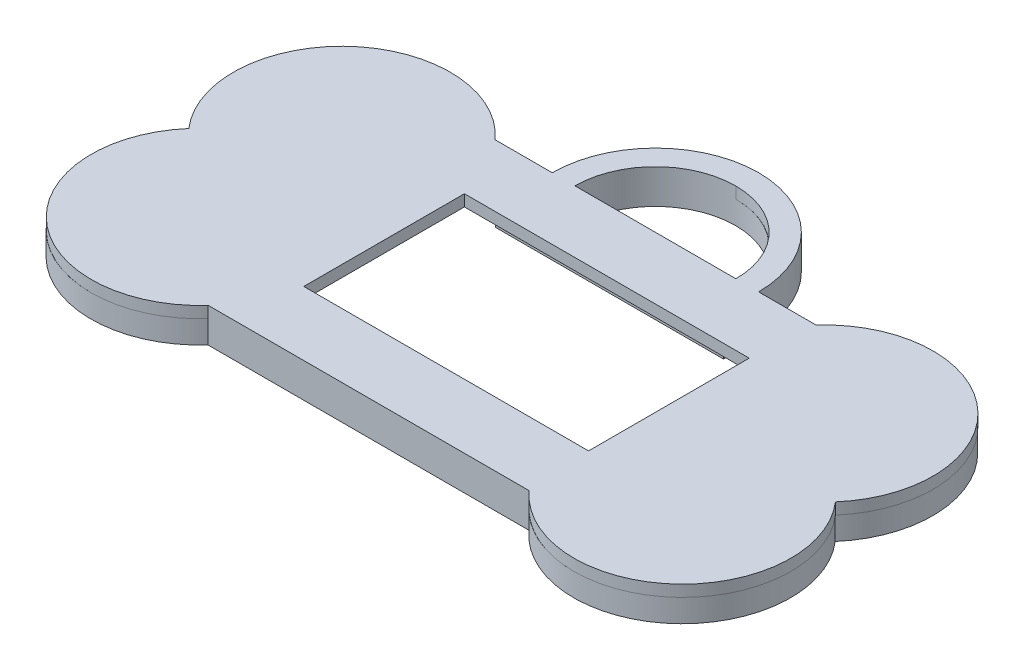
from build123d import *
from build123d.topology import SkipClean

# Parameters (mm, degrees)
SKETCH1_W               = 25.267998505
SKETCH1_H               = 2.54
BOSS_EXTRUDE4_DEPTH     = 2.032
BOSS_EXTRUDE7_OUTLINE_W = 31.52140002
BOSS_EXTRUDE7_OUTLINE_H = 17.78
BOSS_EXTRUDE7_DEPTH     = 1.27
BOSS_EXTRUDE8_START     = -0.508
BOSS_EXTRUDE8_DEPTH     = 0.508


# Read off the part's stored shape, not the designer's step: Boss-Extrude7
with BuildPart() as part:
    # Sketch1 → Boss-Extrude4 (new body)
    # profile 1 of 3: a face of its own
    with BuildSketch(Plane(origin=(0, 0, 0), x_dir=(1, 0, 0), z_dir=(0, 1, 0))):
        with BuildLine():
            ThreePointArc((20.197665706, -14.97393985), (37.082685983, -15.975529809), (38.217517737, 0.901058978))
            ThreePointArc((38.217517737, 0.901058978), (37.082688311, 17.777649884), (20.197665941, 16.776062133))
            Line((20.197665941, 16.776062133), (-15.333719311, 16.776062133))
            ThreePointArc((-15.333719311, 16.776062133), (-32.218740701, 17.777648898), (-33.353569348, 0.901058978))
            ThreePointArc((-33.353569348, 0.901058978), (-32.218738374, -15.975528824), (-15.333719076, -14.97393985))
            Line((-15.333719076, -14.97393985), (20.197665706, -14.97393985))
        make_face()
        with BuildLine():
            ThreePointArc((-29.55002508, 0.901059234), (-31.060989267, -13.57397761), (-16.552025889, -12.43393985))
            Line((-16.552025889, -12.43393985), (21.415972616, -12.43393985))
            ThreePointArc((21.415972616, -12.43393985), (35.924936864, -13.573978674), (34.413973715, 0.901059234))
            ThreePointArc((34.413973715, 0.901059234), (35.924938934, 15.376098834), (21.415972616, 14.236062133))
            Line((21.415972616, 14.236062133), (-16.552025889, 14.236062133))
            ThreePointArc((-16.552025889, 14.236062133), (-31.060991337, 15.376097769), (-29.55002508, 0.901059234))
        make_face(mode=Mode.SUBTRACT)
    # profile 2 of 3: a face of its own
    with BuildSketch(Plane(origin=(0, 0, 0), x_dir=(1, 0, 0), z_dir=(0, 1, 0))):
        with Locations((2.431973364, 12.966062133)):
            Rectangle(SKETCH1_W, SKETCH1_H)
    # profile 3 of 3: a face of its own
    with BuildSketch(Plane(origin=(0, 0, 0), x_dir=(1, 0, 0), z_dir=(0, 1, 0))):
        with BuildLine():
            Line((11.321973315, 16.776062133), (13.861973315, 16.776062133))
            ThreePointArc((13.861973315, 16.776062133), (2.431973315, 28.206062133), (-8.998026685, 16.776062133))
            Line((-8.998026685, 16.776062133), (-6.458026685, 16.776062133))
            ThreePointArc((-6.458026685, 16.776062133), (2.431973315, 25.666062133), (11.321973315, 16.776062133))
        make_face()
    extrude(amount=BOSS_EXTRUDE4_DEPTH)

    # Boss-Extrude7 outline → Boss-Extrude7 (add)
    with BuildSketch(Plane(origin=(0, 2.032, 0), x_dir=(1, 0, 0), z_dir=(0, 1, 0))):
        with BuildLine():
            Line((20.225964487, 16.776056529), (13.861973315, 16.776062133))
            ThreePointArc((13.861973315, 16.776062133), (10.520004553, 24.852487746), (2.448386143, 28.206050349))
            ThreePointArc((2.448386143, 28.206050349), (-5.626159792, 24.854083709), (-8.969728139, 16.776056529))
            Line((-8.969728139, 16.776056529), (-15.305420765, 16.776056529))
            ThreePointArc((-15.305420765, 16.776056529), (-32.190442155, 17.777643295), (-33.325270802, 0.901053374))
            ThreePointArc((-33.325270802, 0.901053374), (-32.190437006, -15.975536914), (-15.305415514, -14.97393985))
            Line((-15.305415514, -14.97393985), (20.225964252, -14.973945454))
            ThreePointArc((20.225964252, -14.973945454), (37.110984529, -15.975535414), (38.245816283, 0.901053374))
            ThreePointArc((38.245816283, 0.901053374), (37.110986856, 17.77764428), (20.225964487, 16.776056529))
        make_face()
        with Locations((3.936415724, 1.014356422)):
            Rectangle(BOSS_EXTRUDE7_OUTLINE_W, BOSS_EXTRUDE7_OUTLINE_H, mode=Mode.SUBTRACT)
        with BuildLine():
            Line((11.350271861, 16.776056529), (-6.458026685, 16.776062133))
            ThreePointArc((-6.458026685, 16.776062133), (-3.848578482, 23.067863872), (2.44788313, 25.666047897))
            ThreePointArc((2.44788313, 25.666047897), (8.742069541, 23.066614366), (11.350271861, 16.776056529))
        make_face(mode=Mode.SUBTRACT)
    extrude(amount=BOSS_EXTRUDE7_DEPTH)

    # Sketch4 → Boss-Extrude8 (add)
    # profile 1 of 2: a face of its own
    with SkipClean():  # the faces are left unmerged after this step: merging them gives an invalid solid
        with BuildSketch(Plane(origin=(0, 0, 0), x_dir=(1, 0, 0), z_dir=(0, 1, 0)).offset(BOSS_EXTRUDE8_START)):
            with BuildLine():
                ThreePointArc((-33.353569348, 0.901058978), (-32.218738374, -15.975528824), (-15.333719076, -14.97393985))
                Line((-15.333719076, -14.97393985), (20.197665706, -14.97393985))
                ThreePointArc((20.197665706, -14.97393985), (37.082685983, -15.975529809), (38.217517737, 0.901058978))
                ThreePointArc((38.217517737, 0.901058978), (37.082688311, 17.777649884), (20.197665941, 16.776062133))
                Line((20.197665941, 16.776062133), (13.861973315, 16.776062133))
                Line((13.861973315, 16.776062133), (11.321973315, 16.776062133))
                Line((11.321973315, 16.776062133), (-6.458026685, 16.776062133))
                Line((-6.458026685, 16.776062133), (-8.998026685, 16.776062133))
                Line((-8.998026685, 16.776062133), (-15.333719311, 16.776062133))
                ThreePointArc((-15.333719311, 16.776062133), (-32.218740701, 17.777648898), (-33.353569348, 0.901058978))
            make_face()
            with BuildLine():
                Line((21.415972616, -12.43393985), (-16.552025889, -12.43393985))
                ThreePointArc((-16.552025889, -12.43393985), (-31.060989267, -13.57397761), (-29.55002508, 0.901059234))
                ThreePointArc((-29.55002508, 0.901059234), (-31.060991337, 15.376097769), (-16.552025889, 14.236062133))
                Line((-16.552025889, 14.236062133), (-10.202025889, 14.236062133))
                Line((-10.202025889, 14.236062133), (15.065972616, 14.236062133))
                Line((15.065972616, 14.236062133), (21.415972616, 14.236062133))
                ThreePointArc((21.415972616, 14.236062133), (35.924938934, 15.376098834), (34.413973715, 0.901059234))
                ThreePointArc((34.413973715, 0.901059234), (35.924936864, -13.573978674), (21.415972616, -12.43393985))
            make_face(mode=Mode.SUBTRACT)
        # profile 2 of 2: a face of its own
        with BuildSketch(Plane(origin=(0, 0, 0), x_dir=(1, 0, 0), z_dir=(0, 1, 0)).offset(BOSS_EXTRUDE8_START)):
            with BuildLine():
                ThreePointArc((13.861973315, 16.776062133), (2.431973315, 28.206062133), (-8.998026685, 16.776062133))
                Line((-8.998026685, 16.776062133), (-6.458026685, 16.776062133))
                ThreePointArc((-6.458026685, 16.776062133), (2.431973315, 25.666062133), (11.321973315, 16.776062133))
                Line((11.321973315, 16.776062133), (13.861973315, 16.776062133))
            make_face()
        extrude(amount=BOSS_EXTRUDE8_DEPTH)


solid = part.part
